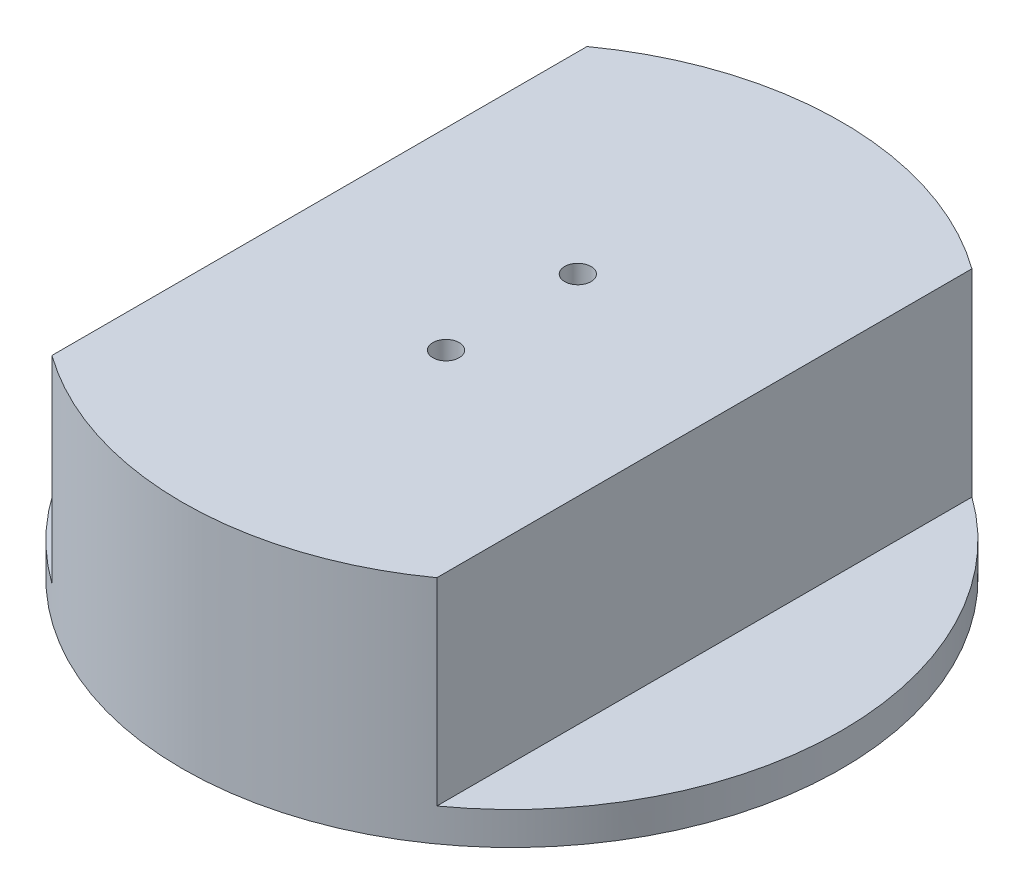
from build123d import *

# Parameters (mm, degrees)
IZIM1_R                     = 50
BASE_DEPTH                  = 5
Y_KSEKLIK_EKSTR_ZYON2_START = 30
Y_KSEKLIK_EKSTR_ZYON2_DEPTH = 30
IZIM2_R                     = 2
BANANA_SLOTU_DEPTH          = 79.89866919


with BuildPart() as part:
    # Çizim1 → base (new body)
    with BuildSketch(Plane(origin=(0, 0, 0), x_dir=(1, 0, 0), z_dir=(0, 1, 0))):
        Circle(IZIM1_R)
    extrude(amount=-BASE_DEPTH)

    # Çizim1<3> → Yükseklik-Ekstrüzyon2 (add)
    with BuildSketch(Plane(origin=(0, 0, 0), x_dir=(1, 0, 0), z_dir=(0, 1, 0)).offset(Y_KSEKLIK_EKSTR_ZYON2_START)):
        with BuildLine():
            ThreePointArc((29.199046601, 40.588368748), (0, 50), (-29.199046601, 40.588368748))
            Line((-29.199046601, 40.588368748), (-29.199046601, 16.5))
            Line((-29.199046601, 16.5), (-29.199046601, -16.5))
            Line((-29.199046601, -16.5), (-29.199046601, -40.588368748))
            ThreePointArc((-29.199046601, -40.588368748), (0, -50), (29.199046601, -40.588368748))
            Line((29.199046601, -40.588368748), (29.199046601, -16.5))
            Line((29.199046601, -16.5), (29.199046601, 16.5))
            Line((29.199046601, 16.5), (29.199046601, 40.588368748))
        make_face()
    extrude(amount=-Y_KSEKLIK_EKSTR_ZYON2_DEPTH)

    # Çizim2 → banana slotu (cut, through all)
    with BuildSketch(Plane(origin=(0, 30, 0), x_dir=(1, 0, 0), z_dir=(0, 1, 0))):
        with Locations((0, 10)):
            Circle(IZIM2_R)
        with Locations((0, -10)):
            Circle(IZIM2_R)
    extrude(amount=-BANANA_SLOTU_DEPTH, mode=Mode.SUBTRACT)


solid = part.part
